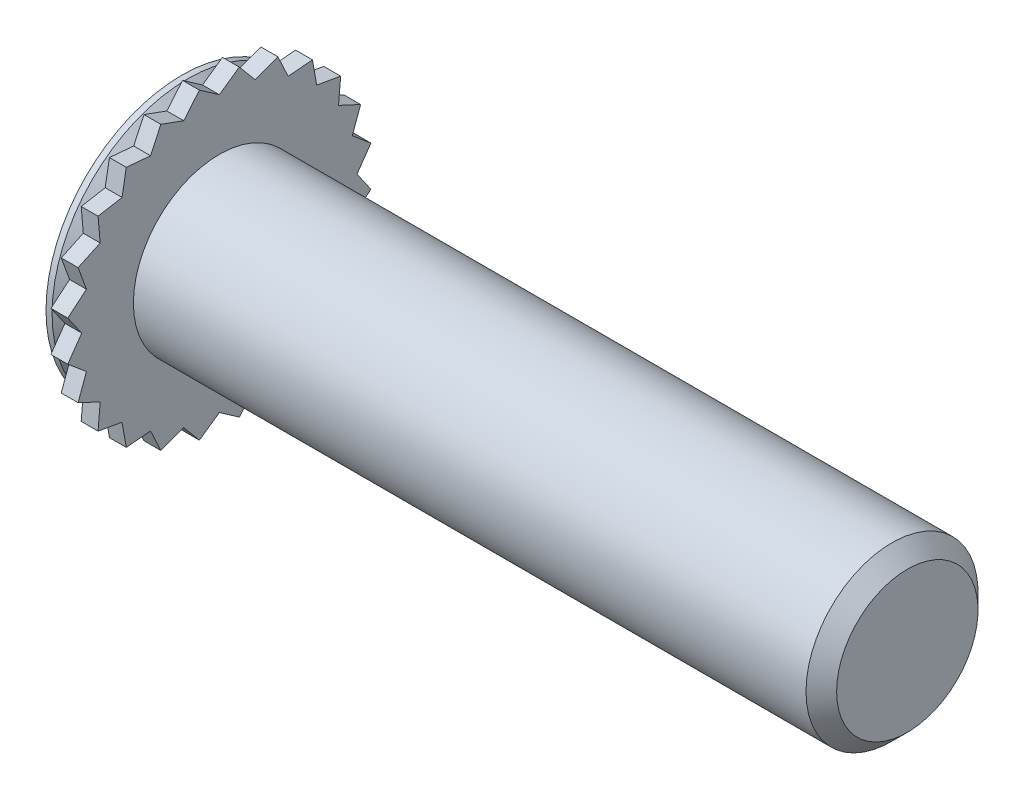
from build123d import *

# Parameters (mm, degrees)
CLINCHCUT_DEPTH    = 0.4905
CLINCHCUTPAT_COUNT = 24
CLINCHCUTPAT_ANGLE = 345


with BuildPart() as part:
    # BodySke → BaseBody (revolve)
    with BuildSketch(Plane.XY):
        Polygon((0, 2.2225), (0, 3.95), (0.1778, 3.95), (0.4905, 3.6373), (0.5995, 3.6373), (0.5995, 4.445), (1.09, 4.445), (1.09, 2.5), (20.645, 2.5), (21.09, 2.055), (21.09, 0), (0.545, 0), (0.545, 1.6775), align=None)
    revolve(axis=Axis((0, 0, 0), (1, 0, 0)))

    # CliRinCutSke → ClinchCut (cut)
    with BuildSketch(Plane(origin=(1.09, 0, 0), x_dir=(0, 0, -1), z_dir=(1, 0, 0))):
        with BuildLine():
            Line((0.580188924, 4.406972409), (0, 4.0005))
            Line((0, 4.0005), (-0.580188924, 4.406972409))
            ThreePointArc((-0.580188924, 4.406972409), (0, 4.445), (0.580188924, 4.406972409))
        make_face()
    clinchcut = extrude(amount=-CLINCHCUT_DEPTH, mode=Mode.SUBTRACT)

    # ClinchCutPat: ClinchCut ×24 about axis
    clinchcutpat_axis = Axis((0, 0, 0), (1, 0, 0))
    for i in range(1, CLINCHCUTPAT_COUNT):
        add(clinchcut.rotate(clinchcutpat_axis, i * CLINCHCUTPAT_ANGLE / (CLINCHCUTPAT_COUNT - 1)), mode=Mode.SUBTRACT)


solid = part.part
